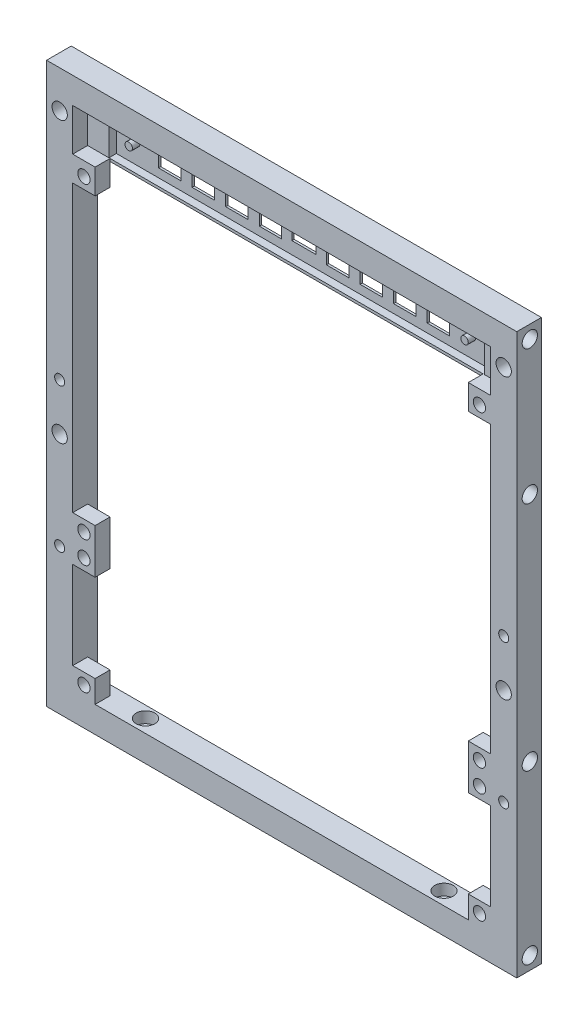
from build123d import *
from build123d.topology import SkipClean

# Parameters (mm, degrees)
SKETCH1_W           = 126
SKETCH1_H           = 150
SKETCH1_W_2         = 112
SKETCH1_H_2         = 136
BOSS_EXTRUDE1_DEPTH = 7
SKETCH2_R           = 2.05
CUT_EXTRUDE1_DEPTH  = 6
SKETCH3_R           = 1.35
CUT_EXTRUDE2_DEPTH  = 157.419308271
SKETCH4_R           = 2.5
CUT_EXTRUDE3_DEPTH  = 3
SKETCH5_R           = 1.35
CUT_EXTRUDE4_DEPTH  = 99.198777996
SKETCH6_R           = 2.5
CUT_EXTRUDE5_DEPTH  = 3
SKETCH7_R           = 2.05
CUT_EXTRUDE6_DEPTH  = 99.198777996
CUT_EXTRUDE7_DEPTH  = 0.2
SKETCH9_W           = 2.7
SKETCH9_H           = 2.7
CUT_EXTRUDE8_DEPTH  = 0.2
SKETCH10_W          = 6
SKETCH10_H          = 6
BOSS_EXTRUDE2_DEPTH = 4
SKETCH11_R          = 1.65
CUT_EXTRUDE9_DEPTH  = 99.030607465
SKETCH12_W          = 112
SKETCH12_H          = 12
BOSS_EXTRUDE3_DEPTH = 1
SKETCH13_W          = 112
SKETCH13_H          = 12
SKETCH13_W_2        = 100.6
SKETCH13_H_2        = 10.6
BOSS_EXTRUDE4_DEPTH = 2
SKETCH14_W          = 6
SKETCH14_H          = 6
SKETCH14_W_2        = 6.5
SKETCH14_H_2        = 4
CUT_EXTRUDE10_DEPTH = 99.132563403
SKETCH15_R          = 1
BOSS_EXTRUDE5_DEPTH = 2
CHAMFER1_SIZE       = 0.4
CHAMFER2_SIZE       = 0.4
CHAMFER3_SIZE       = 0.4
SKETCH16_W          = 6
SKETCH16_H          = 6
BOSS_EXTRUDE7_DEPTH = 4
SKETCH17_R          = 1.65
CUT_EXTRUDE11_DEPTH = 99.030607465


with BuildPart() as part:
    # Sketch1 → Boss-Extrude1 (new body)
    with BuildSketch(Plane.XY):
        Rectangle(SKETCH1_W, SKETCH1_H)
        Rectangle(SKETCH1_W_2, SKETCH1_H_2, mode=Mode.SUBTRACT)
    extrude(amount=BOSS_EXTRUDE1_DEPTH)

    # Sketch2 → Cut-Extrude1 (cut)
    with BuildSketch(Plane.ZY.offset(63)):
        with Locations((3.5, -71.5)):
            Circle(SKETCH2_R)
        with Locations((3.5, 71.5)):
            Circle(SKETCH2_R)
        with Locations((3.5, 35.5)):
            Circle(SKETCH2_R)
        with Locations((3.5, -26.5)):
            Circle(SKETCH2_R)
    cut_extrude1 = extrude(amount=-CUT_EXTRUDE1_DEPTH, mode=Mode.SUBTRACT)

    # Mirror1: Cut-Extrude1 across plane
    add(cut_extrude1.mirror(Plane(origin=(0, 0, 0), x_dir=(0, 0, 1), z_dir=(1, 0, 0))), mode=Mode.SUBTRACT)

    # Sketch3 → Cut-Extrude2 (cut, through all)
    with BuildSketch(Plane(origin=(0, -68, 0), x_dir=(1, 0, 0), z_dir=(0, 1, 0))):
        with Locations(Location((40, -3.5, 0), (0, 0, 270))):
            Circle(SKETCH3_R)
        with Locations(Location((-40, -3.5, 0), (0, 0, 270))):
            Circle(SKETCH3_R)
    extrude(amount=-CUT_EXTRUDE2_DEPTH, mode=Mode.SUBTRACT)

    # Sketch4 → Cut-Extrude3 (cut)
    with BuildSketch(Plane(origin=(0, -68, 0), x_dir=(1, 0, 0), z_dir=(0, 1, 0))):
        with Locations(Location((40, -3.5, 0), (0, 0, 270))):
            Circle(SKETCH4_R)
        with Locations(Location((-40, -3.5, 0), (0, 0, 270))):
            Circle(SKETCH4_R)
    extrude(amount=-CUT_EXTRUDE3_DEPTH, mode=Mode.SUBTRACT)

    # Sketch5 → Cut-Extrude4 (cut, through all)
    with BuildSketch(Plane(origin=(0, 0, 0), x_dir=(-1, 0, 0), z_dir=(0, 0, -1))):
        with Locations((-59.5, 2.6)):
            Circle(SKETCH5_R)
        with Locations(Location((59.5, 2.6, 0), (0, 0, 180))):
            Circle(SKETCH5_R)
        with Locations((-59.5, -36)):
            Circle(SKETCH5_R)
        with Locations(Location((59.5, -36, 0), (0, 0, 180))):
            Circle(SKETCH5_R)
    extrude(amount=-CUT_EXTRUDE4_DEPTH, mode=Mode.SUBTRACT)

    # Sketch6 → Cut-Extrude5 (cut)
    with BuildSketch(Plane(origin=(0, 0, 0), x_dir=(-1, 0, 0), z_dir=(0, 0, -1))):
        with Locations((-59.5, 2.6)):
            Circle(SKETCH6_R)
        with Locations((59.5, 2.6)):
            Circle(SKETCH6_R)
        with Locations((-59.5, -36)):
            Circle(SKETCH6_R)
        with Locations((59.5, -36)):
            Circle(SKETCH6_R)
    extrude(amount=-CUT_EXTRUDE5_DEPTH, mode=Mode.SUBTRACT)

    # Sketch7 → Cut-Extrude6 (cut, through all)
    with BuildSketch(Plane(origin=(0, 0, 0), x_dir=(-1, 0, 0), z_dir=(0, 0, -1))):
        with Locations((-59.5, 65)):
            Circle(SKETCH7_R)
        with Locations((-59.5, -10)):
            Circle(SKETCH7_R)
    cut_extrude6 = extrude(amount=-CUT_EXTRUDE6_DEPTH, mode=Mode.SUBTRACT)

    # Mirror2: Cut-Extrude6 across plane
    add(cut_extrude6.mirror(Plane(origin=(0, 0, 0), x_dir=(0, 0, 1), z_dir=(1, 0, 0))), mode=Mode.SUBTRACT)

    # Sketch8 → Cut-Extrude7 (cut)
    with SkipClean():  # the faces are left unmerged after this step: merging them gives an invalid solid
        with BuildSketch(Plane(origin=(0, 0, 3), x_dir=(-1, 0, 0), z_dir=(0, 0, -1))):
            with BuildLine():
                Line((-60.85, 0.495837459), (-60.85, 4.704162541))
                ThreePointArc((-60.85, 4.704162541), (-59.5, 5.1), (-58.15, 4.704162541))
                Line((-58.15, 4.704162541), (-58.15, 0.495837459))
                ThreePointArc((-58.15, 0.495837459), (-59.5, 0.1), (-60.85, 0.495837459))
            make_face()
            with BuildLine():
                Line((-60.85, -38.104162541), (-60.85, -33.895837459))
                ThreePointArc((-60.85, -33.895837459), (-59.5, -33.5), (-58.15, -33.895837459))
                Line((-58.15, -33.895837459), (-58.15, -38.104162541))
                ThreePointArc((-58.15, -38.104162541), (-59.5, -38.5), (-60.85, -38.104162541))
            make_face()
        cut_extrude7 = extrude(amount=-CUT_EXTRUDE7_DEPTH, mode=Mode.SUBTRACT)

    # Sketch9 → Cut-Extrude8 (cut)
    with SkipClean():  # the faces are left unmerged after this step: merging them gives an invalid solid
        with BuildSketch(Plane(origin=(0, 0, 3.2), x_dir=(-1, 0, 0), z_dir=(0, 0, -1))):
            with Locations((-59.5, 2.6)):
                Rectangle(SKETCH9_W, SKETCH9_H)
            with Locations((-59.5, -36)):
                Rectangle(SKETCH9_W, SKETCH9_H)
        cut_extrude8 = extrude(amount=-CUT_EXTRUDE8_DEPTH, mode=Mode.SUBTRACT)

    # Mirror3: Cut-Extrude7, Cut-Extrude8 across plane
    with SkipClean():  # the faces are left unmerged after this step: merging them gives an invalid solid
        add(cut_extrude7.mirror(Plane(origin=(0, 0, 0), x_dir=(0, 0, 1), z_dir=(1, 0, 0))), mode=Mode.SUBTRACT)
        add(cut_extrude8.mirror(Plane(origin=(0, 0, 0), x_dir=(0, 0, 1), z_dir=(1, 0, 0))), mode=Mode.SUBTRACT)

    # Sketch10 → Boss-Extrude2 (add)
    with SkipClean():  # the faces are left unmerged after this step: merging them gives an invalid solid
        with BuildSketch(Plane.XY.offset(7)):
            with Locations((53, -65)):
                Rectangle(SKETCH10_W, SKETCH10_H)
            with Locations((53, -35.5)):
                Rectangle(SKETCH10_W, SKETCH10_H)
        boss_extrude2 = extrude(amount=-BOSS_EXTRUDE2_DEPTH)

    # Sketch11 → Cut-Extrude9 (cut, through all)
    with SkipClean():  # the faces are left unmerged after this step: merging them gives an invalid solid
        with BuildSketch(Plane(origin=(0, 0, 3), x_dir=(-1, 0, 0), z_dir=(0, 0, -1))):
            with Locations((-53, -35.5)):
                Circle(SKETCH11_R)
            with Locations((-53, -65)):
                Circle(SKETCH11_R)
        cut_extrude9 = extrude(amount=-CUT_EXTRUDE9_DEPTH, mode=Mode.SUBTRACT)

    # Mirror4: Boss-Extrude2, Cut-Extrude9 across plane
    with SkipClean():  # the faces are left unmerged after this step: merging them gives an invalid solid
        add(boss_extrude2.mirror(Plane(origin=(0, 0, 0), x_dir=(0, 0, 1), z_dir=(1, 0, 0))))
        add(cut_extrude9.mirror(Plane(origin=(0, 0, 0), x_dir=(0, 0, 1), z_dir=(1, 0, 0))), mode=Mode.SUBTRACT)

    # Sketch12 → Boss-Extrude3 (add)
    with SkipClean():  # the faces are left unmerged after this step: merging them gives an invalid solid
        with BuildSketch(Plane(origin=(0, 0, 0), x_dir=(-1, 0, 0), z_dir=(0, 0, -1))):
            with Locations((0, 62)):
                Rectangle(SKETCH12_W, SKETCH12_H)
        extrude(amount=-BOSS_EXTRUDE3_DEPTH)

    # Sketch13 → Boss-Extrude4 (add)
    with SkipClean():  # the faces are left unmerged after this step: merging them gives an invalid solid
        with BuildSketch(Plane.XY.offset(1)):
            with Locations((0, 62)):
                Rectangle(SKETCH13_W, SKETCH13_H)
            with Locations((0, 62)):
                Rectangle(SKETCH13_W_2, SKETCH13_H_2, mode=Mode.SUBTRACT)
        extrude(amount=BOSS_EXTRUDE4_DEPTH)

    # Sketch14 → Cut-Extrude10 (cut, through all)
    with SkipClean():  # the faces are left unmerged after this step: merging them gives an invalid solid
        with BuildSketch(Plane.XY.offset(1)):
            with Locations((-36, 62)):
                Rectangle(SKETCH14_W, SKETCH14_H)
            with Locations((0, 62)):
                Rectangle(SKETCH14_W_2, SKETCH14_H_2)
            with Locations((9, 62)):
                Rectangle(SKETCH14_W, SKETCH14_H)
            with Locations((18, 62)):
                Rectangle(SKETCH14_W, SKETCH14_H)
            with Locations((27, 62)):
                Rectangle(SKETCH14_W, SKETCH14_H)
            with Locations((36, 62)):
                Rectangle(SKETCH14_W, SKETCH14_H)
            with Locations((-27, 62)):
                Rectangle(SKETCH14_W, SKETCH14_H)
            with Locations((-18, 62)):
                Rectangle(SKETCH14_W, SKETCH14_H)
            with Locations((-9, 62)):
                Rectangle(SKETCH14_W, SKETCH14_H)
        extrude(amount=-CUT_EXTRUDE10_DEPTH, mode=Mode.SUBTRACT)

    # Sketch15 → Boss-Extrude5 (add)
    with SkipClean():  # the faces are left unmerged after this step: merging them gives an invalid solid
        with BuildSketch(Plane.XY.offset(1)):
            with Locations(Location((-45, 62, 0), (0, 0, 180))):
                Circle(SKETCH15_R)
            with Locations(Location((45, 62, 0), (0, 0, 180))):
                Circle(SKETCH15_R)
        extrude(amount=BOSS_EXTRUDE5_DEPTH)

    # Chamfer1
    # the kernel refuses this chamfer: 0.4 mm, written as the material it takes off along each edge
    with BuildSketch(Plane(origin=(56, -68, 0), x_dir=(0.9996219169112968, 0, -0.02749587661058673), z_dir=(0, 1, 0)), Plane(origin=(-56, 56, 0), x_dir=(-0.9996219169112968, 0, -0.02749587661058673), z_dir=(0, -1, 0))) as chamfer1_piece_1:
        Polygon((CHAMFER1_SIZE * 0.999621916911, -CHAMFER1_SIZE * 0.0274958766106), (-CHAMFER1_SIZE * 0.0274958766106, -CHAMFER1_SIZE * 0.999621916911), (0, 0), align=None)
    extrude(amount=124, mode=Mode.SUBTRACT)
    with BuildSketch(Plane(origin=(-56, -68, 0), x_dir=(0, -0.9996219169112966, -0.027495876610585532), z_dir=(1, 0, 0))) as chamfer1_piece_2:
        Polygon((CHAMFER1_SIZE * 0.999621916911, -CHAMFER1_SIZE * 0.0274958766106), (-CHAMFER1_SIZE * 0.0274958766106, -CHAMFER1_SIZE * 0.999621916911), (0, 0), align=None)
    extrude(amount=112, mode=Mode.SUBTRACT)
    with BuildSketch(Plane(origin=(-56, 56, 0), x_dir=(0, 0.9996219169112968, -0.02749587661058673), z_dir=(1, 0, 0))) as chamfer1_piece_3:
        Polygon((CHAMFER1_SIZE * 0.999621916911, CHAMFER1_SIZE * 0.0274958766106), (-CHAMFER1_SIZE * 0.0274958766106, CHAMFER1_SIZE * 0.999621916911), (0, 0), align=None)
    extrude(amount=112, mode=Mode.SUBTRACT)
    with BuildSketch(Plane(origin=(-56, -68, 0), x_dir=(0, -0.9996219169112966, -0.027495876610585532), z_dir=(1, 0, 0))) as chamfer1_piece_4a_section:
        Polygon((CHAMFER1_SIZE * 0.999621916911, -CHAMFER1_SIZE * 0.0274958766106), (-CHAMFER1_SIZE * 0.0274958766106, -CHAMFER1_SIZE * 0.999621916911), (0, 0), align=None)
    chamfer1_piece_4a = extrude(amount=113.028673195, mode=Mode.PRIVATE)
    chamfer1_piece_4a = split(chamfer1_piece_4a, bisect_by=Plane(origin=(56, -68.131917451, 0.131917451), z_dir=(1, 0, 0)), keep=Keep.TOP, mode=Mode.PRIVATE)
    with BuildSketch(Plane(origin=(56, -69.028673195, 0), x_dir=(0.9996219169112968, 0, -0.02749587661058673), z_dir=(0, 1, 0))) as chamfer1_piece_4b_section:
        Polygon((CHAMFER1_SIZE * 0.999621916911, -CHAMFER1_SIZE * 0.0274958766106), (-CHAMFER1_SIZE * 0.0274958766106, -CHAMFER1_SIZE * 0.999621916911), (0, 0), align=None)
    chamfer1_piece_4b = extrude(amount=125.028673195, mode=Mode.PRIVATE)
    chamfer1_piece_4b = split(chamfer1_piece_4b, bisect_by=Plane(origin=(56.131917451, -68, 0.131917451), z_dir=(0, -1, 0)), keep=Keep.TOP, mode=Mode.PRIVATE)
    chamfer1_piece_4 = chamfer1_piece_4a & chamfer1_piece_4b
    add(chamfer1_piece_4, mode=Mode.SUBTRACT)
    with BuildSketch(Plane(origin=(56, -68, 0), x_dir=(0.9996219169112968, 0, -0.02749587661058673), z_dir=(0, 1, 0))) as chamfer1_piece_5a_section:
        Polygon((CHAMFER1_SIZE * 0.999621916911, -CHAMFER1_SIZE * 0.0274958766106), (-CHAMFER1_SIZE * 0.0274958766106, -CHAMFER1_SIZE * 0.999621916911), (0, 0), align=None)
    chamfer1_piece_5a = extrude(amount=125.028673195, mode=Mode.PRIVATE)
    chamfer1_piece_5a = split(chamfer1_piece_5a, bisect_by=Plane(origin=(56.131917451, 56, 0.131917451), z_dir=(0, 1, 0)), keep=Keep.TOP, mode=Mode.PRIVATE)
    with BuildSketch(Plane(origin=(-56, 56, 0), x_dir=(0, 0.9996219169112968, -0.02749587661058673), z_dir=(1, 0, 0))) as chamfer1_piece_5b_section:
        Polygon((CHAMFER1_SIZE * 0.999621916911, CHAMFER1_SIZE * 0.0274958766106), (-CHAMFER1_SIZE * 0.0274958766106, CHAMFER1_SIZE * 0.999621916911), (0, 0), align=None)
    chamfer1_piece_5b = extrude(amount=113.028673195, mode=Mode.PRIVATE)
    chamfer1_piece_5b = split(chamfer1_piece_5b, bisect_by=Plane(origin=(56, 56.131917451, 0.131917451), z_dir=(1, 0, 0)), keep=Keep.TOP, mode=Mode.PRIVATE)
    chamfer1_piece_5 = chamfer1_piece_5a & chamfer1_piece_5b
    add(chamfer1_piece_5, mode=Mode.SUBTRACT)
    with BuildSketch(Plane(origin=(-56, 56, 0), x_dir=(-0.9996219169112968, 0, -0.02749587661058673), z_dir=(0, -1, 0))) as chamfer1_piece_6a_section:
        Polygon((CHAMFER1_SIZE * 0.999621916911, -CHAMFER1_SIZE * 0.0274958766106), (-CHAMFER1_SIZE * 0.0274958766106, -CHAMFER1_SIZE * 0.999621916911), (0, 0), align=None)
    chamfer1_piece_6a = extrude(amount=125.028673195, mode=Mode.PRIVATE)
    chamfer1_piece_6a = split(chamfer1_piece_6a, bisect_by=Plane(origin=(-56.131917451, -68, 0.131917451), z_dir=(0, -1, 0)), keep=Keep.TOP, mode=Mode.PRIVATE)
    with BuildSketch(Plane(origin=(-57.028673195, -68, 0), x_dir=(0, -0.9996219169112966, -0.027495876610585532), z_dir=(1, 0, 0))) as chamfer1_piece_6b_section:
        Polygon((CHAMFER1_SIZE * 0.999621916911, -CHAMFER1_SIZE * 0.0274958766106), (-CHAMFER1_SIZE * 0.0274958766106, -CHAMFER1_SIZE * 0.999621916911), (0, 0), align=None)
    chamfer1_piece_6b = extrude(amount=113.028673195, mode=Mode.PRIVATE)
    chamfer1_piece_6b = split(chamfer1_piece_6b, bisect_by=Plane(origin=(-56, -68.131917451, 0.131917451), z_dir=(-1, 0, 0)), keep=Keep.TOP, mode=Mode.PRIVATE)
    chamfer1_piece_6 = chamfer1_piece_6a & chamfer1_piece_6b
    add(chamfer1_piece_6, mode=Mode.SUBTRACT)
    with BuildSketch(Plane(origin=(-56, 57.028673195, 0), x_dir=(-0.9996219169112968, 0, -0.02749587661058673), z_dir=(0, -1, 0))) as chamfer1_piece_7a_section:
        Polygon((CHAMFER1_SIZE * 0.999621916911, -CHAMFER1_SIZE * 0.0274958766106), (-CHAMFER1_SIZE * 0.0274958766106, -CHAMFER1_SIZE * 0.999621916911), (0, 0), align=None)
    chamfer1_piece_7a = extrude(amount=125.028673195, mode=Mode.PRIVATE)
    chamfer1_piece_7a = split(chamfer1_piece_7a, bisect_by=Plane(origin=(-56.131917451, 56, 0.131917451), z_dir=(0, 1, 0)), keep=Keep.TOP, mode=Mode.PRIVATE)
    with BuildSketch(Plane(origin=(-57.028673195, 56, 0), x_dir=(0, 0.9996219169112968, -0.02749587661058673), z_dir=(1, 0, 0))) as chamfer1_piece_7b_section:
        Polygon((CHAMFER1_SIZE * 0.999621916911, CHAMFER1_SIZE * 0.0274958766106), (-CHAMFER1_SIZE * 0.0274958766106, CHAMFER1_SIZE * 0.999621916911), (0, 0), align=None)
    chamfer1_piece_7b = extrude(amount=113.028673195, mode=Mode.PRIVATE)
    chamfer1_piece_7b = split(chamfer1_piece_7b, bisect_by=Plane(origin=(-56, 56.131917451, 0.131917451), z_dir=(-1, 0, 0)), keep=Keep.TOP, mode=Mode.PRIVATE)
    chamfer1_piece_7 = chamfer1_piece_7a & chamfer1_piece_7b
    add(chamfer1_piece_7, mode=Mode.SUBTRACT)

    # Chamfer2
    chamfer2_edges = [part.edges().sort_by_distance(p)[0] for p in [
        (0, -75, 0),
        (-63, 0, 0),
        (0, 75, 0),
        (63, 0, 0),
    ]]
    chamfer(chamfer2_edges, length=CHAMFER2_SIZE)

    # Chamfer3
    chamfer3_edges = [part.edges().sort_by_distance(p)[0] for p in [
        (-6, 62, 0),
        (-9, 59, 0),
        (-12, 62, 0),
        (-9, 65, 0),
        (-15, 62, 0),
        (-18, 59, 0),
        (-21, 62, 0),
        (-18, 65, 0),
        (-24, 62, 0),
        (-27, 59, 0),
        (-30, 62, 0),
        (-27, 65, 0),
        (-33, 62, 0),
        (-36, 59, 0),
        (-39, 62, 0),
        (-36, 65, 0),
        (39, 62, 0),
        (36, 59, 0),
        (33, 62, 0),
        (36, 65, 0),
        (30, 62, 0),
        (27, 59, 0),
        (24, 62, 0),
        (27, 65, 0),
        (21, 62, 0),
        (18, 59, 0),
        (15, 62, 0),
        (18, 65, 0),
        (12, 62, 0),
        (9, 59, 0),
        (6, 62, 0),
        (9, 65, 0),
        (3.25, 62, 0),
        (0, 60, 0),
        (-3.25, 62, 0),
        (0, 64, 0),
    ]]
    chamfer(chamfer3_edges, length=CHAMFER3_SIZE)

    # Sketch16 → Boss-Extrude7 (add)
    with BuildSketch(Plane.XY.offset(7)):
        Polygon((-50, 56), (-50, 56.7), (-56, 56.7), (-56, 56), (-56, 50), (-50, 50), align=None)
        with Locations((-53, -29.5)):
            Rectangle(SKETCH16_W, SKETCH16_H)
        with Locations((53, -29.5)):
            Rectangle(SKETCH16_W, SKETCH16_H)
        Polygon((56, 56), (56, 50), (50, 50), (50, 56), (50, 56.7), (56, 56.7), align=None)
    extrude(amount=-BOSS_EXTRUDE7_DEPTH)

    # Sketch17 → Cut-Extrude11 (cut, through all)
    with BuildSketch(Plane(origin=(0, 0, 3), x_dir=(-1, 0, 0), z_dir=(0, 0, -1))):
        with Locations((-53, -29.5)):
            Circle(SKETCH17_R)
        with Locations((53, -29.5)):
            Circle(SKETCH17_R)
        with Locations((53, 53)):
            Circle(SKETCH17_R)
        with Locations((-53, 53)):
            Circle(SKETCH17_R)
    extrude(amount=-CUT_EXTRUDE11_DEPTH, mode=Mode.SUBTRACT)


solid = part.part
